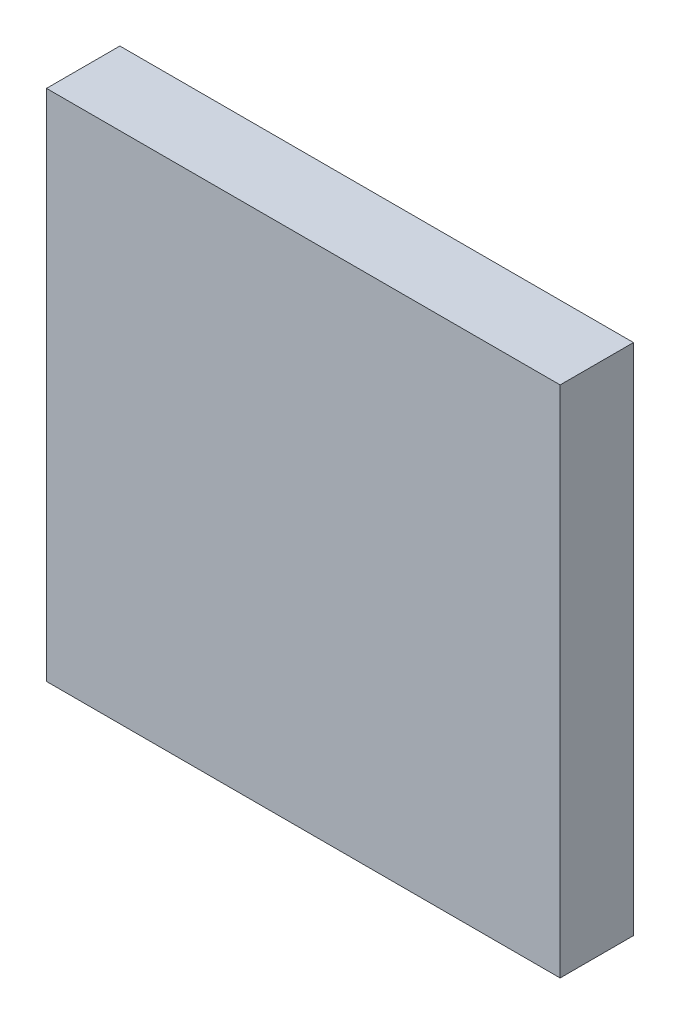
from build123d import *

# Parameters (mm, degrees)
SKETCH_5_W      = 70
SKETCH_5_H      = 70
EXTRUDE_2_DEPTH = 10


with BuildPart() as part:
    # Эскиз5 → Бобышка-Вытянуть2 (new body)
    with BuildSketch(Plane.XY):
        Rectangle(SKETCH_5_W, SKETCH_5_H)
    extrude(amount=EXTRUDE_2_DEPTH)


solid = part.part
